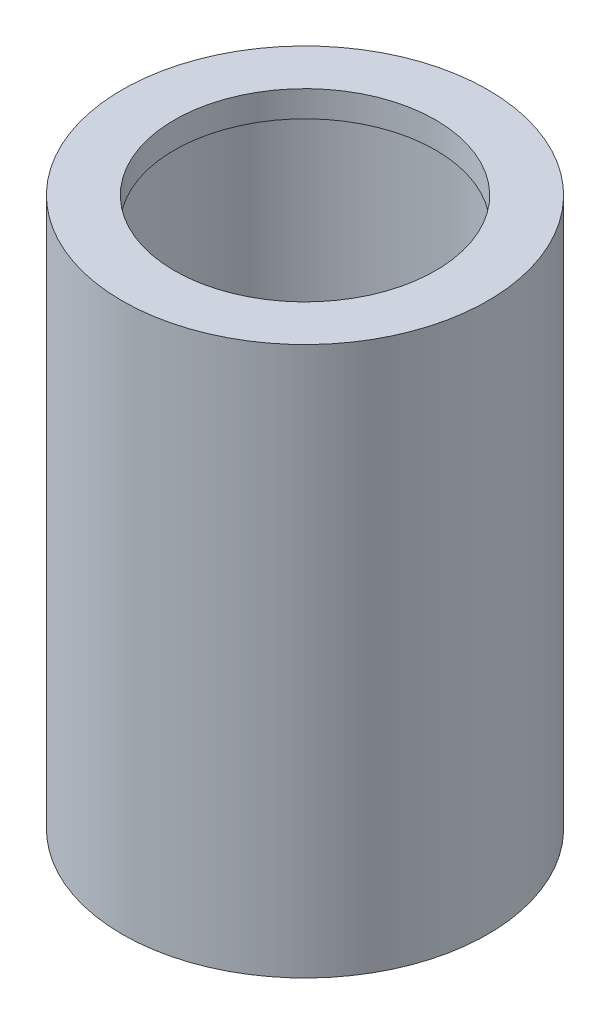
from build123d import *

# Parameters (mm, degrees)
SKETCH1_R           = 35
SKETCH1_R_2         = 30
BOSS_EXTRUDE1_DEPTH = 100
SKETCH2_R           = 35
SKETCH2_R_2         = 25
BOSS_EXTRUDE2_DEPTH = 5


with BuildPart() as part:
    # Sketch1 → Boss-Extrude1 (new body)
    with BuildSketch(Plane(origin=(0, 0, 0), x_dir=(1, 0, 0), z_dir=(0, 1, 0))):
        Circle(SKETCH1_R)
        Circle(SKETCH1_R_2, mode=Mode.SUBTRACT)
    extrude(amount=BOSS_EXTRUDE1_DEPTH)

    # Sketch2 → Boss-Extrude2 (add)
    with BuildSketch(Plane(origin=(0, 100, 0), x_dir=(1, 0, 0), z_dir=(0, 1, 0))):
        Circle(SKETCH2_R)
        Circle(SKETCH2_R_2, mode=Mode.SUBTRACT)
    extrude(amount=BOSS_EXTRUDE2_DEPTH)


solid = part.part
